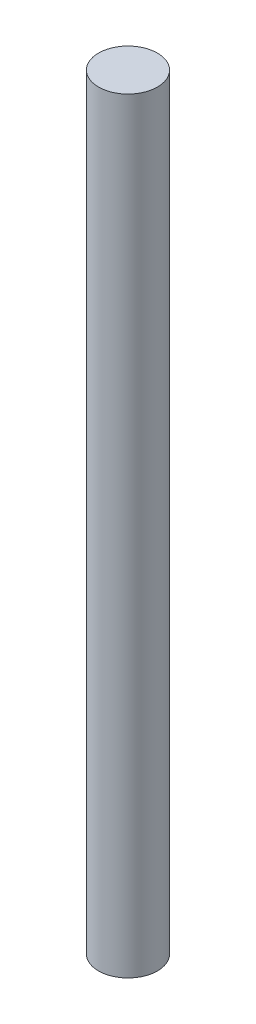
from build123d import *

# Parameters (mm, degrees)
SKETCH1_R           = 2.5
BOSS_EXTRUDE1_DEPTH = 65


with BuildPart() as part:
    # Sketch1 → Boss-Extrude1 (new body)
    with BuildSketch(Plane(origin=(0, 0, 0), x_dir=(1, 0, 0), z_dir=(0, 1, 0))):
        Circle(SKETCH1_R)
    extrude(amount=BOSS_EXTRUDE1_DEPTH)


solid = part.part
